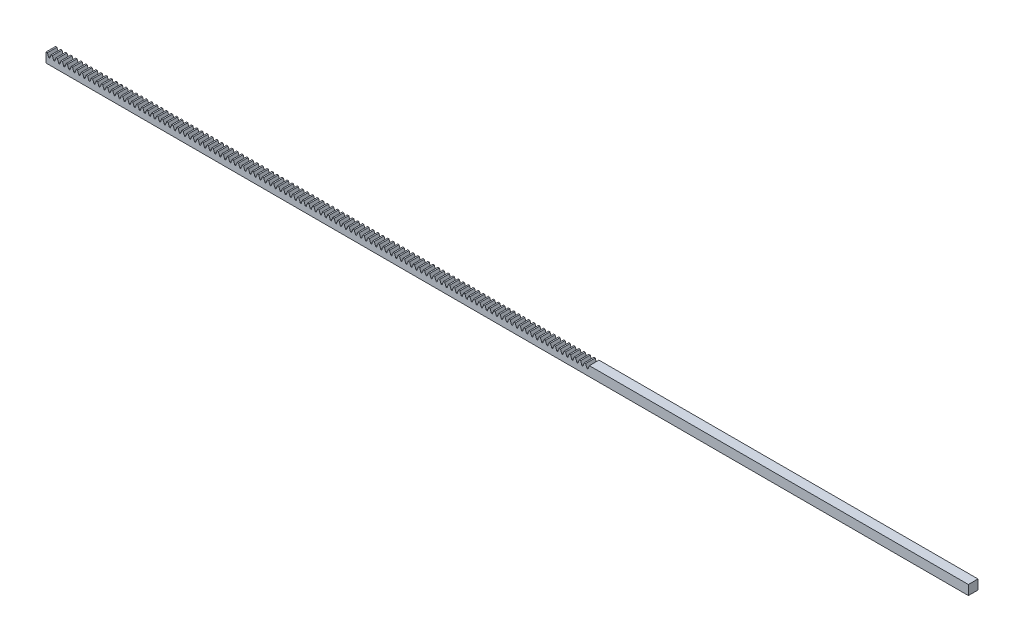
from build123d import *

# Parameters (mm, degrees)
BOSS_EXTRUDE1_DEPTH      = 152.4
BOSS_EXTRUDE1_DEPTH_BACK = 152.4
SKETCH3_W                = 3.175
SKETCH3_H                = 3.175
CUT_EXTRUDE1_DEPTH       = 153.416535561
FILLET1_R                = 0.099598028
LPATTERN1_START          = -1.5875
LPATTERN1_DEPTH          = 3.175


# Read off the part's stored shape, not the designer's step: LPattern1
with BuildPart() as part:
    # Sketch3 → Boss-Extrude1 (new, two sides: drawn at the far end of the back side and taken through both)
    with BuildSketch(Plane(origin=(0, 0, 0), x_dir=(0, 0, -1), z_dir=(1, 0, 0)).offset(-BOSS_EXTRUDE1_DEPTH_BACK)):
        Rectangle(SKETCH3_W, SKETCH3_H)
    extrude(amount=BOSS_EXTRUDE1_DEPTH + BOSS_EXTRUDE1_DEPTH_BACK)

    # Sketch4 → Cut-Extrude1 (cut, symmetric)
    with BuildSketch(Plane.XY):
        Polygon((-151.953986831, 1.5875), (-151.511775129, 0.372533333), (-151.179781702, 0.372533333), (-150.73757, 1.5875), align=None)
    extrude(amount=CUT_EXTRUDE1_DEPTH, both=True, mode=Mode.SUBTRACT)

    # Fillet1
    fillet1_edges = [part.edges().sort_by_distance(p)[0] for p in [
        (-151.179781702, 0.372533333, 0),
        (-151.511775129, 0.372533333, 0),
    ]]
    fillet(fillet1_edges, radius=FILLET1_R)

    # LPattern1 outline → LPattern1 (cut)
    with BuildSketch(Plane.XY.offset(LPATTERN1_START)):
        with BuildLine():
            ThreePointArc((-149.873197371, 0.43806683), (-149.836732921, 0.390545433), (-149.779605839, 0.372533333))
            Line((-149.779605839, 0.372533333), (-149.587090992, 0.372533333))
            ThreePointArc((-149.587090992, 0.372533333), (-149.52996391, 0.390545433), (-149.49349946, 0.43806683))
            Line((-149.49349946, 0.43806683), (-149.07514, 1.5875))
            Line((-149.07514, 1.5875), (-150.291556831, 1.5875))
            Line((-150.291556831, 1.5875), (-149.873197371, 0.43806683))
        make_face()
        with BuildLine():
            Line((27.14244, 1.5875), (25.926023169, 1.5875))
            Line((25.926023169, 1.5875), (26.344382629, 0.43806683))
            ThreePointArc((26.344382629, 0.43806683), (26.380847079, 0.390545433), (26.437974161, 0.372533333))
            Line((26.437974161, 0.372533333), (26.630489008, 0.372533333))
            ThreePointArc((26.630489008, 0.372533333), (26.68761609, 0.390545433), (26.72408054, 0.43806683))
            Line((26.72408054, 0.43806683), (27.14244, 1.5875))
        make_face()
        with BuildLine():
            Line((25.48001, 1.5875), (24.263593169, 1.5875))
            Line((24.263593169, 1.5875), (24.681952629, 0.43806683))
            ThreePointArc((24.681952629, 0.43806683), (24.718417079, 0.390545433), (24.775544161, 0.372533333))
            Line((24.775544161, 0.372533333), (24.968059008, 0.372533333))
            ThreePointArc((24.968059008, 0.372533333), (25.02518609, 0.390545433), (25.06165054, 0.43806683))
            Line((25.06165054, 0.43806683), (25.48001, 1.5875))
        make_face()
        with BuildLine():
            Line((23.81758, 1.5875), (22.601163169, 1.5875))
            Line((22.601163169, 1.5875), (23.019522629, 0.43806683))
            ThreePointArc((23.019522629, 0.43806683), (23.055987079, 0.390545433), (23.113114161, 0.372533333))
            Line((23.113114161, 0.372533333), (23.305629008, 0.372533333))
            ThreePointArc((23.305629008, 0.372533333), (23.36275609, 0.390545433), (23.39922054, 0.43806683))
            Line((23.39922054, 0.43806683), (23.81758, 1.5875))
        make_face()
        with BuildLine():
            Line((22.15515, 1.5875), (20.938733169, 1.5875))
            Line((20.938733169, 1.5875), (21.357092629, 0.43806683))
            ThreePointArc((21.357092629, 0.43806683), (21.393557079, 0.390545433), (21.450684161, 0.372533333))
            Line((21.450684161, 0.372533333), (21.643199008, 0.372533333))
            ThreePointArc((21.643199008, 0.372533333), (21.70032609, 0.390545433), (21.73679054, 0.43806683))
            Line((21.73679054, 0.43806683), (22.15515, 1.5875))
        make_face()
        with BuildLine():
            Line((20.49272, 1.5875), (19.276303169, 1.5875))
            Line((19.276303169, 1.5875), (19.694662629, 0.43806683))
            ThreePointArc((19.694662629, 0.43806683), (19.731127079, 0.390545433), (19.788254161, 0.372533333))
            Line((19.788254161, 0.372533333), (19.980769008, 0.372533333))
            ThreePointArc((19.980769008, 0.372533333), (20.03789609, 0.390545433), (20.07436054, 0.43806683))
            Line((20.07436054, 0.43806683), (20.49272, 1.5875))
        make_face()
        with BuildLine():
            Line((18.83029, 1.5875), (17.613873169, 1.5875))
            Line((17.613873169, 1.5875), (18.032232629, 0.43806683))
            ThreePointArc((18.032232629, 0.43806683), (18.068697079, 0.390545433), (18.125824161, 0.372533333))
            Line((18.125824161, 0.372533333), (18.318339008, 0.372533333))
            ThreePointArc((18.318339008, 0.372533333), (18.37546609, 0.390545433), (18.41193054, 0.43806683))
            Line((18.41193054, 0.43806683), (18.83029, 1.5875))
        make_face()
        with BuildLine():
            Line((17.16786, 1.5875), (15.951443169, 1.5875))
            Line((15.951443169, 1.5875), (16.369802629, 0.43806683))
            ThreePointArc((16.369802629, 0.43806683), (16.406267079, 0.390545433), (16.463394161, 0.372533333))
            Line((16.463394161, 0.372533333), (16.655909008, 0.372533333))
            ThreePointArc((16.655909008, 0.372533333), (16.71303609, 0.390545433), (16.74950054, 0.43806683))
            Line((16.74950054, 0.43806683), (17.16786, 1.5875))
        make_face()
        with BuildLine():
            Line((15.50543, 1.5875), (14.289013169, 1.5875))
            Line((14.289013169, 1.5875), (14.707372629, 0.43806683))
            ThreePointArc((14.707372629, 0.43806683), (14.743837079, 0.390545433), (14.800964161, 0.372533333))
            Line((14.800964161, 0.372533333), (14.993479008, 0.372533333))
            ThreePointArc((14.993479008, 0.372533333), (15.05060609, 0.390545433), (15.08707054, 0.43806683))
            Line((15.08707054, 0.43806683), (15.50543, 1.5875))
        make_face()
        with BuildLine():
            Line((13.843, 1.5875), (12.626583169, 1.5875))
            Line((12.626583169, 1.5875), (13.044942629, 0.43806683))
            ThreePointArc((13.044942629, 0.43806683), (13.081407079, 0.390545433), (13.138534161, 0.372533333))
            Line((13.138534161, 0.372533333), (13.331049008, 0.372533333))
            ThreePointArc((13.331049008, 0.372533333), (13.38817609, 0.390545433), (13.42464054, 0.43806683))
            Line((13.42464054, 0.43806683), (13.843, 1.5875))
        make_face()
        with BuildLine():
            Line((12.18057, 1.5875), (10.964153169, 1.5875))
            Line((10.964153169, 1.5875), (11.382512629, 0.43806683))
            ThreePointArc((11.382512629, 0.43806683), (11.418977079, 0.390545433), (11.476104161, 0.372533333))
            Line((11.476104161, 0.372533333), (11.668619008, 0.372533333))
            ThreePointArc((11.668619008, 0.372533333), (11.72574609, 0.390545433), (11.76221054, 0.43806683))
            Line((11.76221054, 0.43806683), (12.18057, 1.5875))
        make_face()
        with BuildLine():
            Line((10.51814, 1.5875), (9.301723169, 1.5875))
            Line((9.301723169, 1.5875), (9.720082629, 0.43806683))
            ThreePointArc((9.720082629, 0.43806683), (9.756547079, 0.390545433), (9.813674161, 0.372533333))
            Line((9.813674161, 0.372533333), (10.006189008, 0.372533333))
            ThreePointArc((10.006189008, 0.372533333), (10.06331609, 0.390545433), (10.09978054, 0.43806683))
            Line((10.09978054, 0.43806683), (10.51814, 1.5875))
        make_face()
        with BuildLine():
            Line((8.85571, 1.5875), (7.639293169, 1.5875))
            Line((7.639293169, 1.5875), (8.057652629, 0.43806683))
            ThreePointArc((8.057652629, 0.43806683), (8.094117079, 0.390545433), (8.151244161, 0.372533333))
            Line((8.151244161, 0.372533333), (8.343759008, 0.372533333))
            ThreePointArc((8.343759008, 0.372533333), (8.40088609, 0.390545433), (8.43735054, 0.43806683))
            Line((8.43735054, 0.43806683), (8.85571, 1.5875))
        make_face()
        with BuildLine():
            Line((7.19328, 1.5875), (5.976863169, 1.5875))
            Line((5.976863169, 1.5875), (6.395222629, 0.43806683))
            ThreePointArc((6.395222629, 0.43806683), (6.431687079, 0.390545433), (6.488814161, 0.372533333))
            Line((6.488814161, 0.372533333), (6.681329008, 0.372533333))
            ThreePointArc((6.681329008, 0.372533333), (6.73845609, 0.390545433), (6.77492054, 0.43806683))
            Line((6.77492054, 0.43806683), (7.19328, 1.5875))
        make_face()
        with BuildLine():
            Line((5.53085, 1.5875), (4.314433169, 1.5875))
            Line((4.314433169, 1.5875), (4.732792629, 0.43806683))
            ThreePointArc((4.732792629, 0.43806683), (4.769257079, 0.390545433), (4.826384161, 0.372533333))
            Line((4.826384161, 0.372533333), (5.018899008, 0.372533333))
            ThreePointArc((5.018899008, 0.372533333), (5.07602609, 0.390545433), (5.11249054, 0.43806683))
            Line((5.11249054, 0.43806683), (5.53085, 1.5875))
        make_face()
        with BuildLine():
            Line((3.86842, 1.5875), (2.652003169, 1.5875))
            Line((2.652003169, 1.5875), (3.070362629, 0.43806683))
            ThreePointArc((3.070362629, 0.43806683), (3.106827079, 0.390545433), (3.163954161, 0.372533333))
            Line((3.163954161, 0.372533333), (3.356469008, 0.372533333))
            ThreePointArc((3.356469008, 0.372533333), (3.41359609, 0.390545433), (3.45006054, 0.43806683))
            Line((3.45006054, 0.43806683), (3.86842, 1.5875))
        make_face()
        with BuildLine():
            Line((2.20599, 1.5875), (0.989573169, 1.5875))
            Line((0.989573169, 1.5875), (1.407932629, 0.43806683))
            ThreePointArc((1.407932629, 0.43806683), (1.444397079, 0.390545433), (1.501524161, 0.372533333))
            Line((1.501524161, 0.372533333), (1.694039008, 0.372533333))
            ThreePointArc((1.694039008, 0.372533333), (1.75116609, 0.390545433), (1.78763054, 0.43806683))
            Line((1.78763054, 0.43806683), (2.20599, 1.5875))
        make_face()
        with BuildLine():
            Line((0.54356, 1.5875), (-0.672856831, 1.5875))
            Line((-0.672856831, 1.5875), (-0.254497371, 0.43806683))
            ThreePointArc((-0.254497371, 0.43806683), (-0.218032921, 0.390545433), (-0.160905839, 0.372533333))
            Line((-0.160905839, 0.372533333), (0.031609008, 0.372533333))
            ThreePointArc((0.031609008, 0.372533333), (0.08873609, 0.390545433), (0.12520054, 0.43806683))
            Line((0.12520054, 0.43806683), (0.54356, 1.5875))
        make_face()
        with BuildLine():
            Line((-1.11887, 1.5875), (-2.335286831, 1.5875))
            Line((-2.335286831, 1.5875), (-1.916927371, 0.43806683))
            ThreePointArc((-1.916927371, 0.43806683), (-1.880462921, 0.390545433), (-1.823335839, 0.372533333))
            Line((-1.823335839, 0.372533333), (-1.630820992, 0.372533333))
            ThreePointArc((-1.630820992, 0.372533333), (-1.57369391, 0.390545433), (-1.53722946, 0.43806683))
            Line((-1.53722946, 0.43806683), (-1.11887, 1.5875))
        make_face()
        with BuildLine():
            Line((-2.7813, 1.5875), (-3.997716831, 1.5875))
            Line((-3.997716831, 1.5875), (-3.579357371, 0.43806683))
            ThreePointArc((-3.579357371, 0.43806683), (-3.542892921, 0.390545433), (-3.485765839, 0.372533333))
            Line((-3.485765839, 0.372533333), (-3.293250992, 0.372533333))
            ThreePointArc((-3.293250992, 0.372533333), (-3.23612391, 0.390545433), (-3.19965946, 0.43806683))
            Line((-3.19965946, 0.43806683), (-2.7813, 1.5875))
        make_face()
        with BuildLine():
            Line((-4.44373, 1.5875), (-5.660146831, 1.5875))
            Line((-5.660146831, 1.5875), (-5.241787371, 0.43806683))
            ThreePointArc((-5.241787371, 0.43806683), (-5.205322921, 0.390545433), (-5.148195839, 0.372533333))
            Line((-5.148195839, 0.372533333), (-4.955680992, 0.372533333))
            ThreePointArc((-4.955680992, 0.372533333), (-4.89855391, 0.390545433), (-4.86208946, 0.43806683))
            Line((-4.86208946, 0.43806683), (-4.44373, 1.5875))
        make_face()
        with BuildLine():
            Line((-6.10616, 1.5875), (-7.322576831, 1.5875))
            Line((-7.322576831, 1.5875), (-6.904217371, 0.43806683))
            ThreePointArc((-6.904217371, 0.43806683), (-6.867752921, 0.390545433), (-6.810625839, 0.372533333))
            Line((-6.810625839, 0.372533333), (-6.618110992, 0.372533333))
            ThreePointArc((-6.618110992, 0.372533333), (-6.56098391, 0.390545433), (-6.52451946, 0.43806683))
            Line((-6.52451946, 0.43806683), (-6.10616, 1.5875))
        make_face()
        with BuildLine():
            Line((-7.76859, 1.5875), (-8.985006831, 1.5875))
            Line((-8.985006831, 1.5875), (-8.566647371, 0.43806683))
            ThreePointArc((-8.566647371, 0.43806683), (-8.530182921, 0.390545433), (-8.473055839, 0.372533333))
            Line((-8.473055839, 0.372533333), (-8.280540992, 0.372533333))
            ThreePointArc((-8.280540992, 0.372533333), (-8.22341391, 0.390545433), (-8.18694946, 0.43806683))
            Line((-8.18694946, 0.43806683), (-7.76859, 1.5875))
        make_face()
        with BuildLine():
            Line((-9.43102, 1.5875), (-10.647436831, 1.5875))
            Line((-10.647436831, 1.5875), (-10.229077371, 0.43806683))
            ThreePointArc((-10.229077371, 0.43806683), (-10.192612921, 0.390545433), (-10.135485839, 0.372533333))
            Line((-10.135485839, 0.372533333), (-9.942970992, 0.372533333))
            ThreePointArc((-9.942970992, 0.372533333), (-9.88584391, 0.390545433), (-9.84937946, 0.43806683))
            Line((-9.84937946, 0.43806683), (-9.43102, 1.5875))
        make_face()
        with BuildLine():
            Line((-11.09345, 1.5875), (-12.309866831, 1.5875))
            Line((-12.309866831, 1.5875), (-11.891507371, 0.43806683))
            ThreePointArc((-11.891507371, 0.43806683), (-11.855042921, 0.390545433), (-11.797915839, 0.372533333))
            Line((-11.797915839, 0.372533333), (-11.605400992, 0.372533333))
            ThreePointArc((-11.605400992, 0.372533333), (-11.54827391, 0.390545433), (-11.51180946, 0.43806683))
            Line((-11.51180946, 0.43806683), (-11.09345, 1.5875))
        make_face()
        with BuildLine():
            Line((-12.75588, 1.5875), (-13.972296831, 1.5875))
            Line((-13.972296831, 1.5875), (-13.553937371, 0.43806683))
            ThreePointArc((-13.553937371, 0.43806683), (-13.517472921, 0.390545433), (-13.460345839, 0.372533333))
            Line((-13.460345839, 0.372533333), (-13.267830992, 0.372533333))
            ThreePointArc((-13.267830992, 0.372533333), (-13.21070391, 0.390545433), (-13.17423946, 0.43806683))
            Line((-13.17423946, 0.43806683), (-12.75588, 1.5875))
        make_face()
        with BuildLine():
            Line((-14.41831, 1.5875), (-15.634726831, 1.5875))
            Line((-15.634726831, 1.5875), (-15.216367371, 0.43806683))
            ThreePointArc((-15.216367371, 0.43806683), (-15.179902921, 0.390545433), (-15.122775839, 0.372533333))
            Line((-15.122775839, 0.372533333), (-14.930260992, 0.372533333))
            ThreePointArc((-14.930260992, 0.372533333), (-14.87313391, 0.390545433), (-14.83666946, 0.43806683))
            Line((-14.83666946, 0.43806683), (-14.41831, 1.5875))
        make_face()
        with BuildLine():
            Line((-16.08074, 1.5875), (-17.297156831, 1.5875))
            Line((-17.297156831, 1.5875), (-16.878797371, 0.43806683))
            ThreePointArc((-16.878797371, 0.43806683), (-16.842332921, 0.390545433), (-16.785205839, 0.372533333))
            Line((-16.785205839, 0.372533333), (-16.592690992, 0.372533333))
            ThreePointArc((-16.592690992, 0.372533333), (-16.53556391, 0.390545433), (-16.49909946, 0.43806683))
            Line((-16.49909946, 0.43806683), (-16.08074, 1.5875))
        make_face()
        with BuildLine():
            Line((-17.74317, 1.5875), (-18.959586831, 1.5875))
            Line((-18.959586831, 1.5875), (-18.541227371, 0.43806683))
            ThreePointArc((-18.541227371, 0.43806683), (-18.504762921, 0.390545433), (-18.447635839, 0.372533333))
            Line((-18.447635839, 0.372533333), (-18.255120992, 0.372533333))
            ThreePointArc((-18.255120992, 0.372533333), (-18.19799391, 0.390545433), (-18.16152946, 0.43806683))
            Line((-18.16152946, 0.43806683), (-17.74317, 1.5875))
        make_face()
        with BuildLine():
            Line((-19.4056, 1.5875), (-20.622016831, 1.5875))
            Line((-20.622016831, 1.5875), (-20.203657371, 0.43806683))
            ThreePointArc((-20.203657371, 0.43806683), (-20.167192921, 0.390545433), (-20.110065839, 0.372533333))
            Line((-20.110065839, 0.372533333), (-19.917550992, 0.372533333))
            ThreePointArc((-19.917550992, 0.372533333), (-19.86042391, 0.390545433), (-19.82395946, 0.43806683))
            Line((-19.82395946, 0.43806683), (-19.4056, 1.5875))
        make_face()
        with BuildLine():
            Line((-21.06803, 1.5875), (-22.284446831, 1.5875))
            Line((-22.284446831, 1.5875), (-21.866087371, 0.43806683))
            ThreePointArc((-21.866087371, 0.43806683), (-21.829622921, 0.390545433), (-21.772495839, 0.372533333))
            Line((-21.772495839, 0.372533333), (-21.579980992, 0.372533333))
            ThreePointArc((-21.579980992, 0.372533333), (-21.52285391, 0.390545433), (-21.48638946, 0.43806683))
            Line((-21.48638946, 0.43806683), (-21.06803, 1.5875))
        make_face()
        with BuildLine():
            Line((-22.73046, 1.5875), (-23.946876831, 1.5875))
            Line((-23.946876831, 1.5875), (-23.528517371, 0.43806683))
            ThreePointArc((-23.528517371, 0.43806683), (-23.492052921, 0.390545433), (-23.434925839, 0.372533333))
            Line((-23.434925839, 0.372533333), (-23.242410992, 0.372533333))
            ThreePointArc((-23.242410992, 0.372533333), (-23.18528391, 0.390545433), (-23.14881946, 0.43806683))
            Line((-23.14881946, 0.43806683), (-22.73046, 1.5875))
        make_face()
        with BuildLine():
            Line((-24.39289, 1.5875), (-25.609306831, 1.5875))
            Line((-25.609306831, 1.5875), (-25.190947371, 0.43806683))
            ThreePointArc((-25.190947371, 0.43806683), (-25.154482921, 0.390545433), (-25.097355839, 0.372533333))
            Line((-25.097355839, 0.372533333), (-24.904840992, 0.372533333))
            ThreePointArc((-24.904840992, 0.372533333), (-24.84771391, 0.390545433), (-24.81124946, 0.43806683))
            Line((-24.81124946, 0.43806683), (-24.39289, 1.5875))
        make_face()
        with BuildLine():
            Line((-26.05532, 1.5875), (-27.271736831, 1.5875))
            Line((-27.271736831, 1.5875), (-26.853377371, 0.43806683))
            ThreePointArc((-26.853377371, 0.43806683), (-26.816912921, 0.390545433), (-26.759785839, 0.372533333))
            Line((-26.759785839, 0.372533333), (-26.567270992, 0.372533333))
            ThreePointArc((-26.567270992, 0.372533333), (-26.51014391, 0.390545433), (-26.47367946, 0.43806683))
            Line((-26.47367946, 0.43806683), (-26.05532, 1.5875))
        make_face()
        with BuildLine():
            Line((-27.71775, 1.5875), (-28.934166831, 1.5875))
            Line((-28.934166831, 1.5875), (-28.515807371, 0.43806683))
            ThreePointArc((-28.515807371, 0.43806683), (-28.479342921, 0.390545433), (-28.422215839, 0.372533333))
            Line((-28.422215839, 0.372533333), (-28.229700992, 0.372533333))
            ThreePointArc((-28.229700992, 0.372533333), (-28.17257391, 0.390545433), (-28.13610946, 0.43806683))
            Line((-28.13610946, 0.43806683), (-27.71775, 1.5875))
        make_face()
        with BuildLine():
            Line((-29.38018, 1.5875), (-30.596596831, 1.5875))
            Line((-30.596596831, 1.5875), (-30.178237371, 0.43806683))
            ThreePointArc((-30.178237371, 0.43806683), (-30.141772921, 0.390545433), (-30.084645839, 0.372533333))
            Line((-30.084645839, 0.372533333), (-29.892130992, 0.372533333))
            ThreePointArc((-29.892130992, 0.372533333), (-29.83500391, 0.390545433), (-29.79853946, 0.43806683))
            Line((-29.79853946, 0.43806683), (-29.38018, 1.5875))
        make_face()
        with BuildLine():
            Line((-31.04261, 1.5875), (-32.259026831, 1.5875))
            Line((-32.259026831, 1.5875), (-31.840667371, 0.43806683))
            ThreePointArc((-31.840667371, 0.43806683), (-31.804202921, 0.390545433), (-31.747075839, 0.372533333))
            Line((-31.747075839, 0.372533333), (-31.554560992, 0.372533333))
            ThreePointArc((-31.554560992, 0.372533333), (-31.49743391, 0.390545433), (-31.46096946, 0.43806683))
            Line((-31.46096946, 0.43806683), (-31.04261, 1.5875))
        make_face()
        with BuildLine():
            Line((-32.70504, 1.5875), (-33.921456831, 1.5875))
            Line((-33.921456831, 1.5875), (-33.503097371, 0.43806683))
            ThreePointArc((-33.503097371, 0.43806683), (-33.466632921, 0.390545433), (-33.409505839, 0.372533333))
            Line((-33.409505839, 0.372533333), (-33.216990992, 0.372533333))
            ThreePointArc((-33.216990992, 0.372533333), (-33.15986391, 0.390545433), (-33.12339946, 0.43806683))
            Line((-33.12339946, 0.43806683), (-32.70504, 1.5875))
        make_face()
        with BuildLine():
            Line((-34.36747, 1.5875), (-35.583886831, 1.5875))
            Line((-35.583886831, 1.5875), (-35.165527371, 0.43806683))
            ThreePointArc((-35.165527371, 0.43806683), (-35.129062921, 0.390545433), (-35.071935839, 0.372533333))
            Line((-35.071935839, 0.372533333), (-34.879420992, 0.372533333))
            ThreePointArc((-34.879420992, 0.372533333), (-34.82229391, 0.390545433), (-34.78582946, 0.43806683))
            Line((-34.78582946, 0.43806683), (-34.36747, 1.5875))
        make_face()
        with BuildLine():
            Line((-36.0299, 1.5875), (-37.246316831, 1.5875))
            Line((-37.246316831, 1.5875), (-36.827957371, 0.43806683))
            ThreePointArc((-36.827957371, 0.43806683), (-36.791492921, 0.390545433), (-36.734365839, 0.372533333))
            Line((-36.734365839, 0.372533333), (-36.541850992, 0.372533333))
            ThreePointArc((-36.541850992, 0.372533333), (-36.48472391, 0.390545433), (-36.44825946, 0.43806683))
            Line((-36.44825946, 0.43806683), (-36.0299, 1.5875))
        make_face()
        with BuildLine():
            Line((-37.69233, 1.5875), (-38.908746831, 1.5875))
            Line((-38.908746831, 1.5875), (-38.490387371, 0.43806683))
            ThreePointArc((-38.490387371, 0.43806683), (-38.453922921, 0.390545433), (-38.396795839, 0.372533333))
            Line((-38.396795839, 0.372533333), (-38.204280992, 0.372533333))
            ThreePointArc((-38.204280992, 0.372533333), (-38.14715391, 0.390545433), (-38.11068946, 0.43806683))
            Line((-38.11068946, 0.43806683), (-37.69233, 1.5875))
        make_face()
        with BuildLine():
            Line((-39.35476, 1.5875), (-40.571176831, 1.5875))
            Line((-40.571176831, 1.5875), (-40.152817371, 0.43806683))
            ThreePointArc((-40.152817371, 0.43806683), (-40.116352921, 0.390545433), (-40.059225839, 0.372533333))
            Line((-40.059225839, 0.372533333), (-39.866710992, 0.372533333))
            ThreePointArc((-39.866710992, 0.372533333), (-39.80958391, 0.390545433), (-39.77311946, 0.43806683))
            Line((-39.77311946, 0.43806683), (-39.35476, 1.5875))
        make_face()
        with BuildLine():
            Line((-41.01719, 1.5875), (-42.233606831, 1.5875))
            Line((-42.233606831, 1.5875), (-41.815247371, 0.43806683))
            ThreePointArc((-41.815247371, 0.43806683), (-41.778782921, 0.390545433), (-41.721655839, 0.372533333))
            Line((-41.721655839, 0.372533333), (-41.529140992, 0.372533333))
            ThreePointArc((-41.529140992, 0.372533333), (-41.47201391, 0.390545433), (-41.43554946, 0.43806683))
            Line((-41.43554946, 0.43806683), (-41.01719, 1.5875))
        make_face()
        with BuildLine():
            Line((-42.67962, 1.5875), (-43.896036831, 1.5875))
            Line((-43.896036831, 1.5875), (-43.477677371, 0.43806683))
            ThreePointArc((-43.477677371, 0.43806683), (-43.441212921, 0.390545433), (-43.384085839, 0.372533333))
            Line((-43.384085839, 0.372533333), (-43.191570992, 0.372533333))
            ThreePointArc((-43.191570992, 0.372533333), (-43.13444391, 0.390545433), (-43.09797946, 0.43806683))
            Line((-43.09797946, 0.43806683), (-42.67962, 1.5875))
        make_face()
        with BuildLine():
            Line((-44.34205, 1.5875), (-45.558466831, 1.5875))
            Line((-45.558466831, 1.5875), (-45.140107371, 0.43806683))
            ThreePointArc((-45.140107371, 0.43806683), (-45.103642921, 0.390545433), (-45.046515839, 0.372533333))
            Line((-45.046515839, 0.372533333), (-44.854000992, 0.372533333))
            ThreePointArc((-44.854000992, 0.372533333), (-44.79687391, 0.390545433), (-44.76040946, 0.43806683))
            Line((-44.76040946, 0.43806683), (-44.34205, 1.5875))
        make_face()
        with BuildLine():
            Line((-46.00448, 1.5875), (-47.220896831, 1.5875))
            Line((-47.220896831, 1.5875), (-46.802537371, 0.43806683))
            ThreePointArc((-46.802537371, 0.43806683), (-46.766072921, 0.390545433), (-46.708945839, 0.372533333))
            Line((-46.708945839, 0.372533333), (-46.516430992, 0.372533333))
            ThreePointArc((-46.516430992, 0.372533333), (-46.45930391, 0.390545433), (-46.42283946, 0.43806683))
            Line((-46.42283946, 0.43806683), (-46.00448, 1.5875))
        make_face()
        with BuildLine():
            Line((-47.66691, 1.5875), (-48.883326831, 1.5875))
            Line((-48.883326831, 1.5875), (-48.464967371, 0.43806683))
            ThreePointArc((-48.464967371, 0.43806683), (-48.428502921, 0.390545433), (-48.371375839, 0.372533333))
            Line((-48.371375839, 0.372533333), (-48.178860992, 0.372533333))
            ThreePointArc((-48.178860992, 0.372533333), (-48.12173391, 0.390545433), (-48.08526946, 0.43806683))
            Line((-48.08526946, 0.43806683), (-47.66691, 1.5875))
        make_face()
        with BuildLine():
            Line((-49.32934, 1.5875), (-50.545756831, 1.5875))
            Line((-50.545756831, 1.5875), (-50.127397371, 0.43806683))
            ThreePointArc((-50.127397371, 0.43806683), (-50.090932921, 0.390545433), (-50.033805839, 0.372533333))
            Line((-50.033805839, 0.372533333), (-49.841290992, 0.372533333))
            ThreePointArc((-49.841290992, 0.372533333), (-49.78416391, 0.390545433), (-49.74769946, 0.43806683))
            Line((-49.74769946, 0.43806683), (-49.32934, 1.5875))
        make_face()
        with BuildLine():
            Line((-50.99177, 1.5875), (-52.208186831, 1.5875))
            Line((-52.208186831, 1.5875), (-51.789827371, 0.43806683))
            ThreePointArc((-51.789827371, 0.43806683), (-51.753362921, 0.390545433), (-51.696235839, 0.372533333))
            Line((-51.696235839, 0.372533333), (-51.503720992, 0.372533333))
            ThreePointArc((-51.503720992, 0.372533333), (-51.44659391, 0.390545433), (-51.41012946, 0.43806683))
            Line((-51.41012946, 0.43806683), (-50.99177, 1.5875))
        make_face()
        with BuildLine():
            Line((-52.6542, 1.5875), (-53.870616831, 1.5875))
            Line((-53.870616831, 1.5875), (-53.452257371, 0.43806683))
            ThreePointArc((-53.452257371, 0.43806683), (-53.415792921, 0.390545433), (-53.358665839, 0.372533333))
            Line((-53.358665839, 0.372533333), (-53.166150992, 0.372533333))
            ThreePointArc((-53.166150992, 0.372533333), (-53.10902391, 0.390545433), (-53.07255946, 0.43806683))
            Line((-53.07255946, 0.43806683), (-52.6542, 1.5875))
        make_face()
        with BuildLine():
            Line((-54.31663, 1.5875), (-55.533046831, 1.5875))
            Line((-55.533046831, 1.5875), (-55.114687371, 0.43806683))
            ThreePointArc((-55.114687371, 0.43806683), (-55.078222921, 0.390545433), (-55.021095839, 0.372533333))
            Line((-55.021095839, 0.372533333), (-54.828580992, 0.372533333))
            ThreePointArc((-54.828580992, 0.372533333), (-54.77145391, 0.390545433), (-54.73498946, 0.43806683))
            Line((-54.73498946, 0.43806683), (-54.31663, 1.5875))
        make_face()
        with BuildLine():
            Line((-55.97906, 1.5875), (-57.195476831, 1.5875))
            Line((-57.195476831, 1.5875), (-56.777117371, 0.43806683))
            ThreePointArc((-56.777117371, 0.43806683), (-56.740652921, 0.390545433), (-56.683525839, 0.372533333))
            Line((-56.683525839, 0.372533333), (-56.491010992, 0.372533333))
            ThreePointArc((-56.491010992, 0.372533333), (-56.43388391, 0.390545433), (-56.39741946, 0.43806683))
            Line((-56.39741946, 0.43806683), (-55.97906, 1.5875))
        make_face()
        with BuildLine():
            Line((-57.64149, 1.5875), (-58.857906831, 1.5875))
            Line((-58.857906831, 1.5875), (-58.439547371, 0.43806683))
            ThreePointArc((-58.439547371, 0.43806683), (-58.403082921, 0.390545433), (-58.345955839, 0.372533333))
            Line((-58.345955839, 0.372533333), (-58.153440992, 0.372533333))
            ThreePointArc((-58.153440992, 0.372533333), (-58.09631391, 0.390545433), (-58.05984946, 0.43806683))
            Line((-58.05984946, 0.43806683), (-57.64149, 1.5875))
        make_face()
        with BuildLine():
            Line((-59.30392, 1.5875), (-60.520336831, 1.5875))
            Line((-60.520336831, 1.5875), (-60.101977371, 0.43806683))
            ThreePointArc((-60.101977371, 0.43806683), (-60.065512921, 0.390545433), (-60.008385839, 0.372533333))
            Line((-60.008385839, 0.372533333), (-59.815870992, 0.372533333))
            ThreePointArc((-59.815870992, 0.372533333), (-59.75874391, 0.390545433), (-59.72227946, 0.43806683))
            Line((-59.72227946, 0.43806683), (-59.30392, 1.5875))
        make_face()
        with BuildLine():
            Line((-60.96635, 1.5875), (-62.182766831, 1.5875))
            Line((-62.182766831, 1.5875), (-61.764407371, 0.43806683))
            ThreePointArc((-61.764407371, 0.43806683), (-61.727942921, 0.390545433), (-61.670815839, 0.372533333))
            Line((-61.670815839, 0.372533333), (-61.478300992, 0.372533333))
            ThreePointArc((-61.478300992, 0.372533333), (-61.42117391, 0.390545433), (-61.38470946, 0.43806683))
            Line((-61.38470946, 0.43806683), (-60.96635, 1.5875))
        make_face()
        with BuildLine():
            Line((-62.62878, 1.5875), (-63.845196831, 1.5875))
            Line((-63.845196831, 1.5875), (-63.426837371, 0.43806683))
            ThreePointArc((-63.426837371, 0.43806683), (-63.390372921, 0.390545433), (-63.333245839, 0.372533333))
            Line((-63.333245839, 0.372533333), (-63.140730992, 0.372533333))
            ThreePointArc((-63.140730992, 0.372533333), (-63.08360391, 0.390545433), (-63.04713946, 0.43806683))
            Line((-63.04713946, 0.43806683), (-62.62878, 1.5875))
        make_face()
        with BuildLine():
            Line((-64.29121, 1.5875), (-65.507626831, 1.5875))
            Line((-65.507626831, 1.5875), (-65.089267371, 0.43806683))
            ThreePointArc((-65.089267371, 0.43806683), (-65.052802921, 0.390545433), (-64.995675839, 0.372533333))
            Line((-64.995675839, 0.372533333), (-64.803160992, 0.372533333))
            ThreePointArc((-64.803160992, 0.372533333), (-64.74603391, 0.390545433), (-64.70956946, 0.43806683))
            Line((-64.70956946, 0.43806683), (-64.29121, 1.5875))
        make_face()
        with BuildLine():
            Line((-65.95364, 1.5875), (-67.170056831, 1.5875))
            Line((-67.170056831, 1.5875), (-66.751697371, 0.43806683))
            ThreePointArc((-66.751697371, 0.43806683), (-66.715232921, 0.390545433), (-66.658105839, 0.372533333))
            Line((-66.658105839, 0.372533333), (-66.465590992, 0.372533333))
            ThreePointArc((-66.465590992, 0.372533333), (-66.40846391, 0.390545433), (-66.37199946, 0.43806683))
            Line((-66.37199946, 0.43806683), (-65.95364, 1.5875))
        make_face()
        with BuildLine():
            Line((-67.61607, 1.5875), (-68.832486831, 1.5875))
            Line((-68.832486831, 1.5875), (-68.414127371, 0.43806683))
            ThreePointArc((-68.414127371, 0.43806683), (-68.377662921, 0.390545433), (-68.320535839, 0.372533333))
            Line((-68.320535839, 0.372533333), (-68.128020992, 0.372533333))
            ThreePointArc((-68.128020992, 0.372533333), (-68.07089391, 0.390545433), (-68.03442946, 0.43806683))
            Line((-68.03442946, 0.43806683), (-67.61607, 1.5875))
        make_face()
        with BuildLine():
            Line((-69.2785, 1.5875), (-70.494916831, 1.5875))
            Line((-70.494916831, 1.5875), (-70.076557371, 0.43806683))
            ThreePointArc((-70.076557371, 0.43806683), (-70.040092921, 0.390545433), (-69.982965839, 0.372533333))
            Line((-69.982965839, 0.372533333), (-69.790450992, 0.372533333))
            ThreePointArc((-69.790450992, 0.372533333), (-69.73332391, 0.390545433), (-69.69685946, 0.43806683))
            Line((-69.69685946, 0.43806683), (-69.2785, 1.5875))
        make_face()
        with BuildLine():
            Line((-70.94093, 1.5875), (-72.157346831, 1.5875))
            Line((-72.157346831, 1.5875), (-71.738987371, 0.43806683))
            ThreePointArc((-71.738987371, 0.43806683), (-71.702522921, 0.390545433), (-71.645395839, 0.372533333))
            Line((-71.645395839, 0.372533333), (-71.452880992, 0.372533333))
            ThreePointArc((-71.452880992, 0.372533333), (-71.39575391, 0.390545433), (-71.35928946, 0.43806683))
            Line((-71.35928946, 0.43806683), (-70.94093, 1.5875))
        make_face()
        with BuildLine():
            Line((-72.60336, 1.5875), (-73.819776831, 1.5875))
            Line((-73.819776831, 1.5875), (-73.401417371, 0.43806683))
            ThreePointArc((-73.401417371, 0.43806683), (-73.364952921, 0.390545433), (-73.307825839, 0.372533333))
            Line((-73.307825839, 0.372533333), (-73.115310992, 0.372533333))
            ThreePointArc((-73.115310992, 0.372533333), (-73.05818391, 0.390545433), (-73.02171946, 0.43806683))
            Line((-73.02171946, 0.43806683), (-72.60336, 1.5875))
        make_face()
        with BuildLine():
            Line((-74.26579, 1.5875), (-75.482206831, 1.5875))
            Line((-75.482206831, 1.5875), (-75.063847371, 0.43806683))
            ThreePointArc((-75.063847371, 0.43806683), (-75.027382921, 0.390545433), (-74.970255839, 0.372533333))
            Line((-74.970255839, 0.372533333), (-74.777740992, 0.372533333))
            ThreePointArc((-74.777740992, 0.372533333), (-74.72061391, 0.390545433), (-74.68414946, 0.43806683))
            Line((-74.68414946, 0.43806683), (-74.26579, 1.5875))
        make_face()
        with BuildLine():
            Line((-75.92822, 1.5875), (-77.144636831, 1.5875))
            Line((-77.144636831, 1.5875), (-76.726277371, 0.43806683))
            ThreePointArc((-76.726277371, 0.43806683), (-76.689812921, 0.390545433), (-76.632685839, 0.372533333))
            Line((-76.632685839, 0.372533333), (-76.440170992, 0.372533333))
            ThreePointArc((-76.440170992, 0.372533333), (-76.38304391, 0.390545433), (-76.34657946, 0.43806683))
            Line((-76.34657946, 0.43806683), (-75.92822, 1.5875))
        make_face()
        with BuildLine():
            Line((-77.59065, 1.5875), (-78.807066831, 1.5875))
            Line((-78.807066831, 1.5875), (-78.388707371, 0.43806683))
            ThreePointArc((-78.388707371, 0.43806683), (-78.352242921, 0.390545433), (-78.295115839, 0.372533333))
            Line((-78.295115839, 0.372533333), (-78.102600992, 0.372533333))
            ThreePointArc((-78.102600992, 0.372533333), (-78.04547391, 0.390545433), (-78.00900946, 0.43806683))
            Line((-78.00900946, 0.43806683), (-77.59065, 1.5875))
        make_face()
        with BuildLine():
            Line((-79.25308, 1.5875), (-80.469496831, 1.5875))
            Line((-80.469496831, 1.5875), (-80.051137371, 0.43806683))
            ThreePointArc((-80.051137371, 0.43806683), (-80.014672921, 0.390545433), (-79.957545839, 0.372533333))
            Line((-79.957545839, 0.372533333), (-79.765030992, 0.372533333))
            ThreePointArc((-79.765030992, 0.372533333), (-79.70790391, 0.390545433), (-79.67143946, 0.43806683))
            Line((-79.67143946, 0.43806683), (-79.25308, 1.5875))
        make_face()
        with BuildLine():
            Line((-80.91551, 1.5875), (-82.131926831, 1.5875))
            Line((-82.131926831, 1.5875), (-81.713567371, 0.43806683))
            ThreePointArc((-81.713567371, 0.43806683), (-81.677102921, 0.390545433), (-81.619975839, 0.372533333))
            Line((-81.619975839, 0.372533333), (-81.427460992, 0.372533333))
            ThreePointArc((-81.427460992, 0.372533333), (-81.37033391, 0.390545433), (-81.33386946, 0.43806683))
            Line((-81.33386946, 0.43806683), (-80.91551, 1.5875))
        make_face()
        with BuildLine():
            Line((-82.57794, 1.5875), (-83.794356831, 1.5875))
            Line((-83.794356831, 1.5875), (-83.375997371, 0.43806683))
            ThreePointArc((-83.375997371, 0.43806683), (-83.339532921, 0.390545433), (-83.282405839, 0.372533333))
            Line((-83.282405839, 0.372533333), (-83.089890992, 0.372533333))
            ThreePointArc((-83.089890992, 0.372533333), (-83.03276391, 0.390545433), (-82.99629946, 0.43806683))
            Line((-82.99629946, 0.43806683), (-82.57794, 1.5875))
        make_face()
        with BuildLine():
            Line((-84.24037, 1.5875), (-85.456786831, 1.5875))
            Line((-85.456786831, 1.5875), (-85.038427371, 0.43806683))
            ThreePointArc((-85.038427371, 0.43806683), (-85.001962921, 0.390545433), (-84.944835839, 0.372533333))
            Line((-84.944835839, 0.372533333), (-84.752320992, 0.372533333))
            ThreePointArc((-84.752320992, 0.372533333), (-84.69519391, 0.390545433), (-84.65872946, 0.43806683))
            Line((-84.65872946, 0.43806683), (-84.24037, 1.5875))
        make_face()
        with BuildLine():
            Line((-85.9028, 1.5875), (-87.119216831, 1.5875))
            Line((-87.119216831, 1.5875), (-86.700857371, 0.43806683))
            ThreePointArc((-86.700857371, 0.43806683), (-86.664392921, 0.390545433), (-86.607265839, 0.372533333))
            Line((-86.607265839, 0.372533333), (-86.414750992, 0.372533333))
            ThreePointArc((-86.414750992, 0.372533333), (-86.35762391, 0.390545433), (-86.32115946, 0.43806683))
            Line((-86.32115946, 0.43806683), (-85.9028, 1.5875))
        make_face()
        with BuildLine():
            Line((-87.56523, 1.5875), (-88.781646831, 1.5875))
            Line((-88.781646831, 1.5875), (-88.363287371, 0.43806683))
            ThreePointArc((-88.363287371, 0.43806683), (-88.326822921, 0.390545433), (-88.269695839, 0.372533333))
            Line((-88.269695839, 0.372533333), (-88.077180992, 0.372533333))
            ThreePointArc((-88.077180992, 0.372533333), (-88.02005391, 0.390545433), (-87.98358946, 0.43806683))
            Line((-87.98358946, 0.43806683), (-87.56523, 1.5875))
        make_face()
        with BuildLine():
            Line((-89.22766, 1.5875), (-90.444076831, 1.5875))
            Line((-90.444076831, 1.5875), (-90.025717371, 0.43806683))
            ThreePointArc((-90.025717371, 0.43806683), (-89.989252921, 0.390545433), (-89.932125839, 0.372533333))
            Line((-89.932125839, 0.372533333), (-89.739610992, 0.372533333))
            ThreePointArc((-89.739610992, 0.372533333), (-89.68248391, 0.390545433), (-89.64601946, 0.43806683))
            Line((-89.64601946, 0.43806683), (-89.22766, 1.5875))
        make_face()
        with BuildLine():
            Line((-90.89009, 1.5875), (-92.106506831, 1.5875))
            Line((-92.106506831, 1.5875), (-91.688147371, 0.43806683))
            ThreePointArc((-91.688147371, 0.43806683), (-91.651682921, 0.390545433), (-91.594555839, 0.372533333))
            Line((-91.594555839, 0.372533333), (-91.402040992, 0.372533333))
            ThreePointArc((-91.402040992, 0.372533333), (-91.34491391, 0.390545433), (-91.30844946, 0.43806683))
            Line((-91.30844946, 0.43806683), (-90.89009, 1.5875))
        make_face()
        with BuildLine():
            Line((-92.55252, 1.5875), (-93.768936831, 1.5875))
            Line((-93.768936831, 1.5875), (-93.350577371, 0.43806683))
            ThreePointArc((-93.350577371, 0.43806683), (-93.314112921, 0.390545433), (-93.256985839, 0.372533333))
            Line((-93.256985839, 0.372533333), (-93.064470992, 0.372533333))
            ThreePointArc((-93.064470992, 0.372533333), (-93.00734391, 0.390545433), (-92.97087946, 0.43806683))
            Line((-92.97087946, 0.43806683), (-92.55252, 1.5875))
        make_face()
        with BuildLine():
            Line((-94.21495, 1.5875), (-95.431366831, 1.5875))
            Line((-95.431366831, 1.5875), (-95.013007371, 0.43806683))
            ThreePointArc((-95.013007371, 0.43806683), (-94.976542921, 0.390545433), (-94.919415839, 0.372533333))
            Line((-94.919415839, 0.372533333), (-94.726900992, 0.372533333))
            ThreePointArc((-94.726900992, 0.372533333), (-94.66977391, 0.390545433), (-94.63330946, 0.43806683))
            Line((-94.63330946, 0.43806683), (-94.21495, 1.5875))
        make_face()
        with BuildLine():
            Line((-95.87738, 1.5875), (-97.093796831, 1.5875))
            Line((-97.093796831, 1.5875), (-96.675437371, 0.43806683))
            ThreePointArc((-96.675437371, 0.43806683), (-96.638972921, 0.390545433), (-96.581845839, 0.372533333))
            Line((-96.581845839, 0.372533333), (-96.389330992, 0.372533333))
            ThreePointArc((-96.389330992, 0.372533333), (-96.33220391, 0.390545433), (-96.29573946, 0.43806683))
            Line((-96.29573946, 0.43806683), (-95.87738, 1.5875))
        make_face()
        with BuildLine():
            Line((-97.53981, 1.5875), (-98.756226831, 1.5875))
            Line((-98.756226831, 1.5875), (-98.337867371, 0.43806683))
            ThreePointArc((-98.337867371, 0.43806683), (-98.301402921, 0.390545433), (-98.244275839, 0.372533333))
            Line((-98.244275839, 0.372533333), (-98.051760992, 0.372533333))
            ThreePointArc((-98.051760992, 0.372533333), (-97.99463391, 0.390545433), (-97.95816946, 0.43806683))
            Line((-97.95816946, 0.43806683), (-97.53981, 1.5875))
        make_face()
        with BuildLine():
            Line((-99.20224, 1.5875), (-100.418656831, 1.5875))
            Line((-100.418656831, 1.5875), (-100.000297371, 0.43806683))
            ThreePointArc((-100.000297371, 0.43806683), (-99.963832921, 0.390545433), (-99.906705839, 0.372533333))
            Line((-99.906705839, 0.372533333), (-99.714190992, 0.372533333))
            ThreePointArc((-99.714190992, 0.372533333), (-99.65706391, 0.390545433), (-99.62059946, 0.43806683))
            Line((-99.62059946, 0.43806683), (-99.20224, 1.5875))
        make_face()
        with BuildLine():
            Line((-100.86467, 1.5875), (-102.081086831, 1.5875))
            Line((-102.081086831, 1.5875), (-101.662727371, 0.43806683))
            ThreePointArc((-101.662727371, 0.43806683), (-101.626262921, 0.390545433), (-101.569135839, 0.372533333))
            Line((-101.569135839, 0.372533333), (-101.376620992, 0.372533333))
            ThreePointArc((-101.376620992, 0.372533333), (-101.31949391, 0.390545433), (-101.28302946, 0.43806683))
            Line((-101.28302946, 0.43806683), (-100.86467, 1.5875))
        make_face()
        with BuildLine():
            Line((-102.5271, 1.5875), (-103.743516831, 1.5875))
            Line((-103.743516831, 1.5875), (-103.325157371, 0.43806683))
            ThreePointArc((-103.325157371, 0.43806683), (-103.288692921, 0.390545433), (-103.231565839, 0.372533333))
            Line((-103.231565839, 0.372533333), (-103.039050992, 0.372533333))
            ThreePointArc((-103.039050992, 0.372533333), (-102.98192391, 0.390545433), (-102.94545946, 0.43806683))
            Line((-102.94545946, 0.43806683), (-102.5271, 1.5875))
        make_face()
        with BuildLine():
            Line((-104.18953, 1.5875), (-105.405946831, 1.5875))
            Line((-105.405946831, 1.5875), (-104.987587371, 0.43806683))
            ThreePointArc((-104.987587371, 0.43806683), (-104.951122921, 0.390545433), (-104.893995839, 0.372533333))
            Line((-104.893995839, 0.372533333), (-104.701480992, 0.372533333))
            ThreePointArc((-104.701480992, 0.372533333), (-104.64435391, 0.390545433), (-104.60788946, 0.43806683))
            Line((-104.60788946, 0.43806683), (-104.18953, 1.5875))
        make_face()
        with BuildLine():
            Line((-105.85196, 1.5875), (-107.068376831, 1.5875))
            Line((-107.068376831, 1.5875), (-106.650017371, 0.43806683))
            ThreePointArc((-106.650017371, 0.43806683), (-106.613552921, 0.390545433), (-106.556425839, 0.372533333))
            Line((-106.556425839, 0.372533333), (-106.363910992, 0.372533333))
            ThreePointArc((-106.363910992, 0.372533333), (-106.30678391, 0.390545433), (-106.27031946, 0.43806683))
            Line((-106.27031946, 0.43806683), (-105.85196, 1.5875))
        make_face()
        with BuildLine():
            Line((-107.51439, 1.5875), (-108.730806831, 1.5875))
            Line((-108.730806831, 1.5875), (-108.312447371, 0.43806683))
            ThreePointArc((-108.312447371, 0.43806683), (-108.275982921, 0.390545433), (-108.218855839, 0.372533333))
            Line((-108.218855839, 0.372533333), (-108.026340992, 0.372533333))
            ThreePointArc((-108.026340992, 0.372533333), (-107.96921391, 0.390545433), (-107.93274946, 0.43806683))
            Line((-107.93274946, 0.43806683), (-107.51439, 1.5875))
        make_face()
        with BuildLine():
            Line((-109.17682, 1.5875), (-110.393236831, 1.5875))
            Line((-110.393236831, 1.5875), (-109.974877371, 0.43806683))
            ThreePointArc((-109.974877371, 0.43806683), (-109.938412921, 0.390545433), (-109.881285839, 0.372533333))
            Line((-109.881285839, 0.372533333), (-109.688770992, 0.372533333))
            ThreePointArc((-109.688770992, 0.372533333), (-109.63164391, 0.390545433), (-109.59517946, 0.43806683))
            Line((-109.59517946, 0.43806683), (-109.17682, 1.5875))
        make_face()
        with BuildLine():
            Line((-110.83925, 1.5875), (-112.055666831, 1.5875))
            Line((-112.055666831, 1.5875), (-111.637307371, 0.43806683))
            ThreePointArc((-111.637307371, 0.43806683), (-111.600842921, 0.390545433), (-111.543715839, 0.372533333))
            Line((-111.543715839, 0.372533333), (-111.351200992, 0.372533333))
            ThreePointArc((-111.351200992, 0.372533333), (-111.29407391, 0.390545433), (-111.25760946, 0.43806683))
            Line((-111.25760946, 0.43806683), (-110.83925, 1.5875))
        make_face()
        with BuildLine():
            Line((-112.50168, 1.5875), (-113.718096831, 1.5875))
            Line((-113.718096831, 1.5875), (-113.299737371, 0.43806683))
            ThreePointArc((-113.299737371, 0.43806683), (-113.263272921, 0.390545433), (-113.206145839, 0.372533333))
            Line((-113.206145839, 0.372533333), (-113.013630992, 0.372533333))
            ThreePointArc((-113.013630992, 0.372533333), (-112.95650391, 0.390545433), (-112.92003946, 0.43806683))
            Line((-112.92003946, 0.43806683), (-112.50168, 1.5875))
        make_face()
        with BuildLine():
            Line((-114.16411, 1.5875), (-115.380526831, 1.5875))
            Line((-115.380526831, 1.5875), (-114.962167371, 0.43806683))
            ThreePointArc((-114.962167371, 0.43806683), (-114.925702921, 0.390545433), (-114.868575839, 0.372533333))
            Line((-114.868575839, 0.372533333), (-114.676060992, 0.372533333))
            ThreePointArc((-114.676060992, 0.372533333), (-114.61893391, 0.390545433), (-114.58246946, 0.43806683))
            Line((-114.58246946, 0.43806683), (-114.16411, 1.5875))
        make_face()
        with BuildLine():
            Line((-115.82654, 1.5875), (-117.042956831, 1.5875))
            Line((-117.042956831, 1.5875), (-116.624597371, 0.43806683))
            ThreePointArc((-116.624597371, 0.43806683), (-116.588132921, 0.390545433), (-116.531005839, 0.372533333))
            Line((-116.531005839, 0.372533333), (-116.338490992, 0.372533333))
            ThreePointArc((-116.338490992, 0.372533333), (-116.28136391, 0.390545433), (-116.24489946, 0.43806683))
            Line((-116.24489946, 0.43806683), (-115.82654, 1.5875))
        make_face()
        with BuildLine():
            Line((-117.48897, 1.5875), (-118.705386831, 1.5875))
            Line((-118.705386831, 1.5875), (-118.287027371, 0.43806683))
            ThreePointArc((-118.287027371, 0.43806683), (-118.250562921, 0.390545433), (-118.193435839, 0.372533333))
            Line((-118.193435839, 0.372533333), (-118.000920992, 0.372533333))
            ThreePointArc((-118.000920992, 0.372533333), (-117.94379391, 0.390545433), (-117.90732946, 0.43806683))
            Line((-117.90732946, 0.43806683), (-117.48897, 1.5875))
        make_face()
        with BuildLine():
            Line((-119.1514, 1.5875), (-120.367816831, 1.5875))
            Line((-120.367816831, 1.5875), (-119.949457371, 0.43806683))
            ThreePointArc((-119.949457371, 0.43806683), (-119.912992921, 0.390545433), (-119.855865839, 0.372533333))
            Line((-119.855865839, 0.372533333), (-119.663350992, 0.372533333))
            ThreePointArc((-119.663350992, 0.372533333), (-119.60622391, 0.390545433), (-119.56975946, 0.43806683))
            Line((-119.56975946, 0.43806683), (-119.1514, 1.5875))
        make_face()
        with BuildLine():
            Line((-120.81383, 1.5875), (-122.030246831, 1.5875))
            Line((-122.030246831, 1.5875), (-121.611887371, 0.43806683))
            ThreePointArc((-121.611887371, 0.43806683), (-121.575422921, 0.390545433), (-121.518295839, 0.372533333))
            Line((-121.518295839, 0.372533333), (-121.325780992, 0.372533333))
            ThreePointArc((-121.325780992, 0.372533333), (-121.26865391, 0.390545433), (-121.23218946, 0.43806683))
            Line((-121.23218946, 0.43806683), (-120.81383, 1.5875))
        make_face()
        with BuildLine():
            Line((-122.47626, 1.5875), (-123.692676831, 1.5875))
            Line((-123.692676831, 1.5875), (-123.274317371, 0.43806683))
            ThreePointArc((-123.274317371, 0.43806683), (-123.237852921, 0.390545433), (-123.180725839, 0.372533333))
            Line((-123.180725839, 0.372533333), (-122.988210992, 0.372533333))
            ThreePointArc((-122.988210992, 0.372533333), (-122.93108391, 0.390545433), (-122.89461946, 0.43806683))
            Line((-122.89461946, 0.43806683), (-122.47626, 1.5875))
        make_face()
        with BuildLine():
            Line((-124.13869, 1.5875), (-125.355106831, 1.5875))
            Line((-125.355106831, 1.5875), (-124.936747371, 0.43806683))
            ThreePointArc((-124.936747371, 0.43806683), (-124.900282921, 0.390545433), (-124.843155839, 0.372533333))
            Line((-124.843155839, 0.372533333), (-124.650640992, 0.372533333))
            ThreePointArc((-124.650640992, 0.372533333), (-124.59351391, 0.390545433), (-124.55704946, 0.43806683))
            Line((-124.55704946, 0.43806683), (-124.13869, 1.5875))
        make_face()
        with BuildLine():
            Line((-125.80112, 1.5875), (-127.017536831, 1.5875))
            Line((-127.017536831, 1.5875), (-126.599177371, 0.43806683))
            ThreePointArc((-126.599177371, 0.43806683), (-126.562712921, 0.390545433), (-126.505585839, 0.372533333))
            Line((-126.505585839, 0.372533333), (-126.313070992, 0.372533333))
            ThreePointArc((-126.313070992, 0.372533333), (-126.25594391, 0.390545433), (-126.21947946, 0.43806683))
            Line((-126.21947946, 0.43806683), (-125.80112, 1.5875))
        make_face()
        with BuildLine():
            Line((-127.46355, 1.5875), (-128.679966831, 1.5875))
            Line((-128.679966831, 1.5875), (-128.261607371, 0.43806683))
            ThreePointArc((-128.261607371, 0.43806683), (-128.225142921, 0.390545433), (-128.168015839, 0.372533333))
            Line((-128.168015839, 0.372533333), (-127.975500992, 0.372533333))
            ThreePointArc((-127.975500992, 0.372533333), (-127.91837391, 0.390545433), (-127.88190946, 0.43806683))
            Line((-127.88190946, 0.43806683), (-127.46355, 1.5875))
        make_face()
        with BuildLine():
            Line((-129.12598, 1.5875), (-130.342396831, 1.5875))
            Line((-130.342396831, 1.5875), (-129.924037371, 0.43806683))
            ThreePointArc((-129.924037371, 0.43806683), (-129.887572921, 0.390545433), (-129.830445839, 0.372533333))
            Line((-129.830445839, 0.372533333), (-129.637930992, 0.372533333))
            ThreePointArc((-129.637930992, 0.372533333), (-129.58080391, 0.390545433), (-129.54433946, 0.43806683))
            Line((-129.54433946, 0.43806683), (-129.12598, 1.5875))
        make_face()
        with BuildLine():
            Line((-130.78841, 1.5875), (-132.004826831, 1.5875))
            Line((-132.004826831, 1.5875), (-131.586467371, 0.43806683))
            ThreePointArc((-131.586467371, 0.43806683), (-131.550002921, 0.390545433), (-131.492875839, 0.372533333))
            Line((-131.492875839, 0.372533333), (-131.300360992, 0.372533333))
            ThreePointArc((-131.300360992, 0.372533333), (-131.24323391, 0.390545433), (-131.20676946, 0.43806683))
            Line((-131.20676946, 0.43806683), (-130.78841, 1.5875))
        make_face()
        with BuildLine():
            Line((-132.45084, 1.5875), (-133.667256831, 1.5875))
            Line((-133.667256831, 1.5875), (-133.248897371, 0.43806683))
            ThreePointArc((-133.248897371, 0.43806683), (-133.212432921, 0.390545433), (-133.155305839, 0.372533333))
            Line((-133.155305839, 0.372533333), (-132.962790992, 0.372533333))
            ThreePointArc((-132.962790992, 0.372533333), (-132.90566391, 0.390545433), (-132.86919946, 0.43806683))
            Line((-132.86919946, 0.43806683), (-132.45084, 1.5875))
        make_face()
        with BuildLine():
            Line((-134.11327, 1.5875), (-135.329686831, 1.5875))
            Line((-135.329686831, 1.5875), (-134.911327371, 0.43806683))
            ThreePointArc((-134.911327371, 0.43806683), (-134.874862921, 0.390545433), (-134.817735839, 0.372533333))
            Line((-134.817735839, 0.372533333), (-134.625220992, 0.372533333))
            ThreePointArc((-134.625220992, 0.372533333), (-134.56809391, 0.390545433), (-134.53162946, 0.43806683))
            Line((-134.53162946, 0.43806683), (-134.11327, 1.5875))
        make_face()
        with BuildLine():
            Line((-135.7757, 1.5875), (-136.992116831, 1.5875))
            Line((-136.992116831, 1.5875), (-136.573757371, 0.43806683))
            ThreePointArc((-136.573757371, 0.43806683), (-136.537292921, 0.390545433), (-136.480165839, 0.372533333))
            Line((-136.480165839, 0.372533333), (-136.287650992, 0.372533333))
            ThreePointArc((-136.287650992, 0.372533333), (-136.23052391, 0.390545433), (-136.19405946, 0.43806683))
            Line((-136.19405946, 0.43806683), (-135.7757, 1.5875))
        make_face()
        with BuildLine():
            Line((-137.43813, 1.5875), (-138.654546831, 1.5875))
            Line((-138.654546831, 1.5875), (-138.236187371, 0.43806683))
            ThreePointArc((-138.236187371, 0.43806683), (-138.199722921, 0.390545433), (-138.142595839, 0.372533333))
            Line((-138.142595839, 0.372533333), (-137.950080992, 0.372533333))
            ThreePointArc((-137.950080992, 0.372533333), (-137.89295391, 0.390545433), (-137.85648946, 0.43806683))
            Line((-137.85648946, 0.43806683), (-137.43813, 1.5875))
        make_face()
        with BuildLine():
            Line((-139.10056, 1.5875), (-140.316976831, 1.5875))
            Line((-140.316976831, 1.5875), (-139.898617371, 0.43806683))
            ThreePointArc((-139.898617371, 0.43806683), (-139.862152921, 0.390545433), (-139.805025839, 0.372533333))
            Line((-139.805025839, 0.372533333), (-139.612510992, 0.372533333))
            ThreePointArc((-139.612510992, 0.372533333), (-139.55538391, 0.390545433), (-139.51891946, 0.43806683))
            Line((-139.51891946, 0.43806683), (-139.10056, 1.5875))
        make_face()
        with BuildLine():
            Line((-140.76299, 1.5875), (-141.979406831, 1.5875))
            Line((-141.979406831, 1.5875), (-141.561047371, 0.43806683))
            ThreePointArc((-141.561047371, 0.43806683), (-141.524582921, 0.390545433), (-141.467455839, 0.372533333))
            Line((-141.467455839, 0.372533333), (-141.274940992, 0.372533333))
            ThreePointArc((-141.274940992, 0.372533333), (-141.21781391, 0.390545433), (-141.18134946, 0.43806683))
            Line((-141.18134946, 0.43806683), (-140.76299, 1.5875))
        make_face()
        with BuildLine():
            Line((-142.42542, 1.5875), (-143.641836831, 1.5875))
            Line((-143.641836831, 1.5875), (-143.223477371, 0.43806683))
            ThreePointArc((-143.223477371, 0.43806683), (-143.187012921, 0.390545433), (-143.129885839, 0.372533333))
            Line((-143.129885839, 0.372533333), (-142.937370992, 0.372533333))
            ThreePointArc((-142.937370992, 0.372533333), (-142.88024391, 0.390545433), (-142.84377946, 0.43806683))
            Line((-142.84377946, 0.43806683), (-142.42542, 1.5875))
        make_face()
        with BuildLine():
            Line((-144.08785, 1.5875), (-145.304266831, 1.5875))
            Line((-145.304266831, 1.5875), (-144.885907371, 0.43806683))
            ThreePointArc((-144.885907371, 0.43806683), (-144.849442921, 0.390545433), (-144.792315839, 0.372533333))
            Line((-144.792315839, 0.372533333), (-144.599800992, 0.372533333))
            ThreePointArc((-144.599800992, 0.372533333), (-144.54267391, 0.390545433), (-144.50620946, 0.43806683))
            Line((-144.50620946, 0.43806683), (-144.08785, 1.5875))
        make_face()
        with BuildLine():
            Line((-145.75028, 1.5875), (-146.966696831, 1.5875))
            Line((-146.966696831, 1.5875), (-146.548337371, 0.43806683))
            ThreePointArc((-146.548337371, 0.43806683), (-146.511872921, 0.390545433), (-146.454745839, 0.372533333))
            Line((-146.454745839, 0.372533333), (-146.262230992, 0.372533333))
            ThreePointArc((-146.262230992, 0.372533333), (-146.20510391, 0.390545433), (-146.16863946, 0.43806683))
            Line((-146.16863946, 0.43806683), (-145.75028, 1.5875))
        make_face()
        with BuildLine():
            Line((-147.41271, 1.5875), (-148.629126831, 1.5875))
            Line((-148.629126831, 1.5875), (-148.210767371, 0.43806683))
            ThreePointArc((-148.210767371, 0.43806683), (-148.174302921, 0.390545433), (-148.117175839, 0.372533333))
            Line((-148.117175839, 0.372533333), (-147.924660992, 0.372533333))
            ThreePointArc((-147.924660992, 0.372533333), (-147.86753391, 0.390545433), (-147.83106946, 0.43806683))
            Line((-147.83106946, 0.43806683), (-147.41271, 1.5875))
        make_face()
    extrude(amount=LPATTERN1_DEPTH, mode=Mode.SUBTRACT)


solid = part.part
